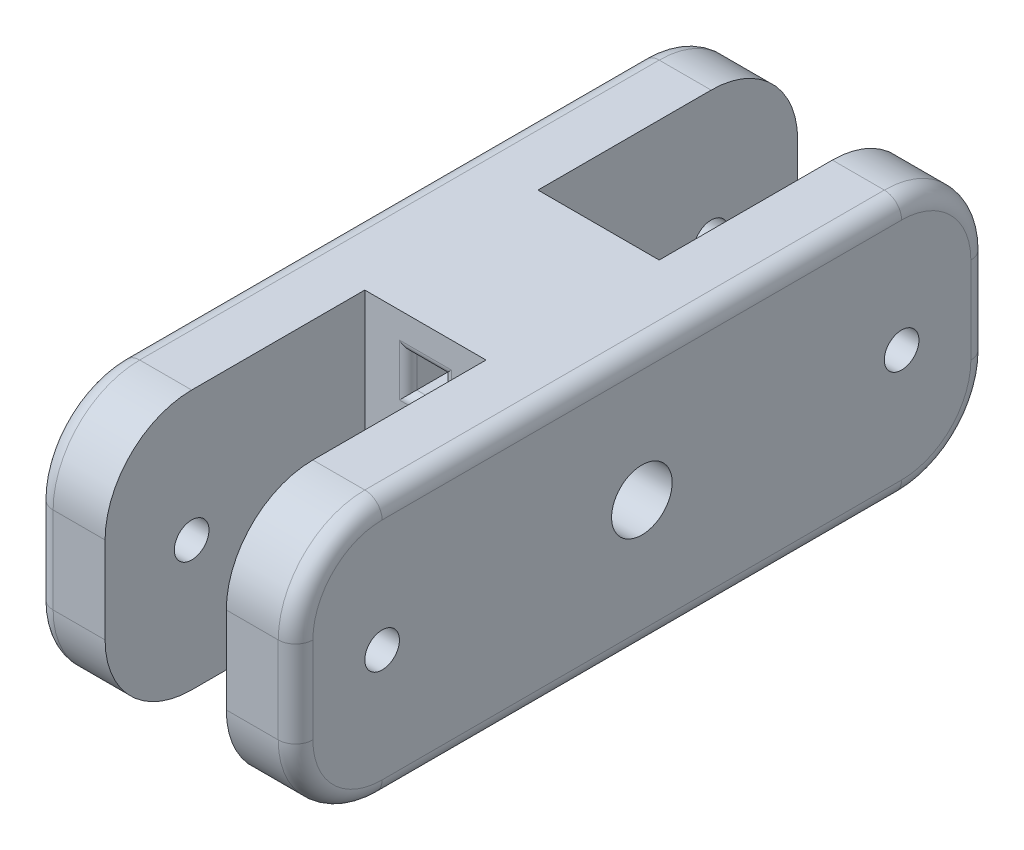
from build123d import *

# Parameters (mm, degrees)
BOTTOM_SECTION_BASE_SKETCH_W             = 15
BOTTOM_SECTION_BASE_SKETCH_H             = 15
BOTTOM_SECTION_EXTRUDE_DEPTH             = 40
HINGE_CUTOUT_SKETCH_W                    = 7
HINGE_CUTOUT_SKETCH_H                    = 15
HINGE_CUTOUT_EXTRUDED_CUT_DEPTH          = 15
HINGE_HOLE_SKETCH_R                      = 1
HINGE_HOLE_EXTRUDED_CUT_DEPTH            = 44.373378932
HINGER_CORNER_FILLETS_R                  = 5
STYLE_FILLETS_R                          = 1
ROUTING_HOLES_SKETCH_W                   = 2
ROUTING_HOLES_SKETCH_H                   = 2
ROUTING_HOLES_EXTRUDED_CUT_DEPTH         = 42.382363393
BACKING_START                            = -3.5
BACKING_EXTRUDE_DEPTH                    = 7
BOTTOM_SECTION_CONNECTION_HOLE_R         = 1.75
BOTTOM_SECTION_CONNECTION_HOLE_CUT_DEPTH = 3
SKETCH2_W                                = 7
SKETCH2_H                                = 2
BOTTOM_EXTENSION_EXTRUDE_DEPTH           = 6.5
FILLET1_R                                = 0.5


# Read off the part's stored shape, not the designer's step: Backing Extrude
with BuildPart() as part:
    # Bottom Section Base Sketch → Bottom Section Extrude (new body)
    with BuildSketch(Plane.XY):
        Rectangle(BOTTOM_SECTION_BASE_SKETCH_W, BOTTOM_SECTION_BASE_SKETCH_H)
    extrude(amount=BOTTOM_SECTION_EXTRUDE_DEPTH)

    # Hinge Cutout Sketch → Hinge Cutout Extruded Cut (cut)
    with BuildSketch(Plane.XY):
        Rectangle(HINGE_CUTOUT_SKETCH_W, HINGE_CUTOUT_SKETCH_H)
    hinge_cutout_extruded_cut = extrude(amount=HINGE_CUTOUT_EXTRUDED_CUT_DEPTH, mode=Mode.SUBTRACT)

    # Hinge Hole Sketch → Hinge Hole Extruded Cut (cut, through all)
    with BuildSketch(Plane(origin=(7.5, 0, 0), x_dir=(0, 0, -1), z_dir=(1, 0, 0))):
        with Locations((-5, 0)):
            Circle(HINGE_HOLE_SKETCH_R)
    hinge_hole_extruded_cut = extrude(amount=-HINGE_HOLE_EXTRUDED_CUT_DEPTH, mode=Mode.SUBTRACT)

    # Hinge and Hole Cutout Mirror: Hinge Cutout Extruded Cut, Hinge Hole Extruded Cut across plane
    add(hinge_cutout_extruded_cut.mirror(Plane.XY.offset(20)), mode=Mode.SUBTRACT)
    add(hinge_hole_extruded_cut.mirror(Plane.XY.offset(20)), mode=Mode.SUBTRACT)

    # Hinger Corner Fillets
    hinger_corner_fillets_edges = [part.edges().sort_by_distance(p)[0] for p in [
        (5.5, -7.5, 0),
        (-5.5, 7.5, 0),
        (-5.5, -7.5, 40),
        (-5.5, 7.5, 40),
        (5.5, -7.5, 40),
        (-5.5, -7.5, 0),
        (5.5, 7.5, 0),
        (5.5, 7.5, 40),
    ]]
    fillet(hinger_corner_fillets_edges, radius=HINGER_CORNER_FILLETS_R)

    # Style Fillets
    style_fillets_edges = [part.edges().sort_by_distance(p)[0] for p in [
        (7.5, 0, 40),
        (7.5, 7.5, 20),
        (-7.5, 7.5, 20),
        (7.5, 0, 0),
        (7.5, -7.5, 20),
        (7.5, 6.035533906, 1.464466094),
        (7.5, -6.035533906, 1.464466094),
        (7.5, -6.035533906, 38.535533906),
        (7.5, 6.035533906, 38.535533906),
        (-7.5, -7.5, 20),
        (-7.5, 0, 40),
        (-7.5, 0, 0),
        (-7.5, -6.035533906, 1.464466094),
        (-7.5, 6.035533906, 1.464466094),
        (-7.5, 6.035533906, 38.535533906),
        (-7.5, -6.035533906, 38.535533906),
    ]]
    fillet(style_fillets_edges, radius=STYLE_FILLETS_R)

    # Routing Holes Sketch → Routing Holes Extruded Cut (cut, through all)
    with BuildSketch(Plane.XY):
        with Locations((0, 4.5)):
            Rectangle(ROUTING_HOLES_SKETCH_W, ROUTING_HOLES_SKETCH_H)
        with Locations((0, -4.5)):
            Rectangle(ROUTING_HOLES_SKETCH_W, ROUTING_HOLES_SKETCH_H)
    extrude(amount=ROUTING_HOLES_EXTRUDED_CUT_DEPTH, mode=Mode.SUBTRACT)

    # Backing Extrude outline → Backing Extrude (add)
    with BuildSketch(Plane.YZ.offset(BACKING_START)):
        Polygon((-7.5, 32.145884327), (-7.5, 25), (-5.5, 25), (-5.5, 32.106829325), align=None)
    extrude(amount=BACKING_EXTRUDE_DEPTH)

    # Bottom Section Connection Hole → Bottom Section Connection Hole Cut (cut)
    with BuildSketch(Plane(origin=(7.5, 0, 0), x_dir=(0, 0, -1), z_dir=(1, 0, 0))):
        with Locations((-20, 0)):
            Circle(BOTTOM_SECTION_CONNECTION_HOLE_R)
    bottom_section_connection_hole_cut = extrude(amount=-BOTTOM_SECTION_CONNECTION_HOLE_CUT_DEPTH, mode=Mode.SUBTRACT)

    # Sketch2 → Bottom extension Extrude (add)
    with BuildSketch(Plane(origin=(0, 0, 15), x_dir=(-1, 0, 0), z_dir=(0, 0, -1))):
        with Locations((0, -6.5)):
            Rectangle(SKETCH2_W, SKETCH2_H)
    extrude(amount=BOTTOM_EXTENSION_EXTRUDE_DEPTH)

    # Connection Hole Mirror: Bottom Section Connection Hole Cut across plane
    add(bottom_section_connection_hole_cut.mirror(Plane(origin=(0, 0, 0), x_dir=(0, 0, 1), z_dir=(1, 0, 0))), mode=Mode.SUBTRACT)

    # Fillet1
    fillet1_edges = [part.edges().sort_by_distance(p)[0] for p in [
        (-1, -4.5, 25),
        (0, -3.5, 25),
        (1, -4.5, 25),
        (0, 5.5, 25),
        (1, 4.5, 25),
        (0, 3.5, 25),
        (-1, 4.5, 25),
        (-1, 4.5, 15),
        (0, 3.5, 15),
        (1, 4.5, 15),
        (0, 5.5, 15),
        (1, -4.5, 15),
        (0, -3.5, 15),
        (-1, -4.5, 15),
    ]]
    fillet(fillet1_edges, radius=FILLET1_R)


solid = part.part
